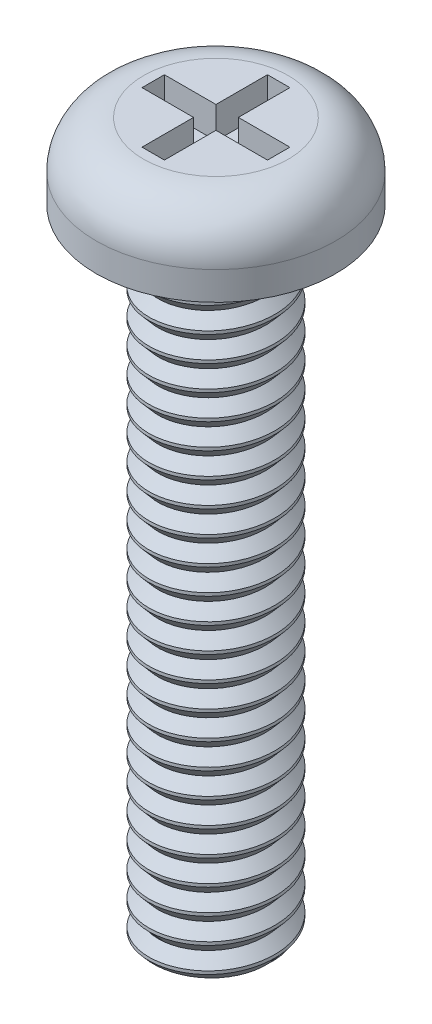
from build123d import *

# Parameters (mm, degrees)
SKETCH1_R           = 1.9
BOSS_EXTRUDE1_DEPTH = 1.2
CUT_EXTRUDE1_DEPTH  = 0.5
FILLET1_R           = 0.75
SKETCH3_R           = 1
BOSS_EXTRUDE2_DEPTH = 10
CUT_SWEEP1_PITCH    = 0.4
CUT_SWEEP1_TO       = 10


with BuildPart() as part:
    # Sketch1 → Boss-Extrude1 (new body)
    with BuildSketch(Plane(origin=(0, 0, 0), x_dir=(1, 0, 0), z_dir=(0, 1, 0))):
        with Locations(Location((0, 0, 0), (0, 0, 270))):
            Circle(SKETCH1_R)
    extrude(amount=BOSS_EXTRUDE1_DEPTH)

    # Sketch2 → Cut-Extrude1 (cut)
    with BuildSketch(Plane(origin=(0, 1.2, 0), x_dir=(1, 0, 0), z_dir=(0, 1, 0))):
        Polygon((-0.996132208, 0.177817561), (-0.996132208, -0.177817561), (-0.177817561, -0.177817561), (-0.177817561, -0.996132208), (0.177817561, -0.996132208), (0.177817561, -0.177817561), (0.996132208, -0.177817561), (0.996132208, 0.177817561), (0.177817561, 0.177817561), (0.177817561, 0.996132208), (-0.177817561, 0.996132208), (-0.177817561, 0.177817561), align=None)
    extrude(amount=-CUT_EXTRUDE1_DEPTH, mode=Mode.SUBTRACT)

    # Fillet1
    fillet1_edges = [part.edges().sort_by_distance(p)[0] for p in [
        (0, 1.2, -1.9),
    ]]
    fillet(fillet1_edges, radius=FILLET1_R)

    # Sketch3 → Boss-Extrude2 (add)
    with BuildSketch(Plane(origin=(0, 0, 0), x_dir=(1, 0, 0), z_dir=(0, 1, 0))):
        with Locations(Location((0, 0, 0), (0, 0, 270))):
            Circle(SKETCH3_R)
    extrude(amount=-BOSS_EXTRUDE2_DEPTH)

    # Cut-Sweep1: arcs per turn and ends read off the stored shape
    # Cut-Sweep1: the profile of Sketch4 profile screwed along a right-hand helix through 26.666667 turns, 6 arcs to a turn; built about Z, then put on its axis
    cut_sweep1_z = Axis((0, 0, 0), (0, 0, 1))
    cut_sweep1_corners = [(0.85, 0, -0.4), (1.0003, 0, -0.22465), (1.0003, 0, -0.57535)]
    with BuildLine(mode=Mode.PRIVATE) as cut_sweep1_profile:
        Line(cut_sweep1_corners[0], cut_sweep1_corners[1])
        Line(cut_sweep1_corners[1], cut_sweep1_corners[2])
        Line(cut_sweep1_corners[2], cut_sweep1_corners[0])
    cut_sweep1_cap = Face(cut_sweep1_profile.wire())
    cut_sweep1_turn_angles = [0, 30, 60, 90, 120, 150, 180, 210, 240, 270, 300, 330, 360]
    cut_sweep1_turn_weights = [1, 0.8660254037844387, 1, 0.8660254037844387, 1, 0.8660254037844387, 1, 0.8660254037844387, 1, 0.8660254037844387, 1, 0.8660254037844387, 1]
    cut_sweep1_turn_rails = [Edge.make_bspline([Vector(p[0], p[1], 0).rotate(cut_sweep1_z, cut_sweep1_turn_angles[k]) / cut_sweep1_turn_weights[k] + Vector(0, 0, p[2] + CUT_SWEEP1_PITCH * cut_sweep1_turn_angles[k] / 360) for k in range(13)], [0, 0, 0, 1, 1, 2, 2, 3, 3, 4, 4, 5, 5, 6, 6, 6], 2, cut_sweep1_turn_weights) for p in cut_sweep1_corners]
    cut_sweep1_turn_sides = [Face.make_surface_from_curves(cut_sweep1_turn_rails[p[0]], cut_sweep1_turn_rails[p[1]]) for p in [(0, 1), (1, 2), (2, 0)]]
    cut_sweep1_last_angles = [9360, 9390, 9420, 9450, 9480, 9510, 9540, 9570, 9600]
    cut_sweep1_last_weights = [1, 0.8660254037844387, 1, 0.8660254037844387, 1, 0.8660254037844387, 1, 0.8660254037844387, 1]
    cut_sweep1_last_rails = [Edge.make_bspline([Vector(p[0], p[1], 0).rotate(cut_sweep1_z, cut_sweep1_last_angles[k]) / cut_sweep1_last_weights[k] + Vector(0, 0, p[2] + CUT_SWEEP1_PITCH * cut_sweep1_last_angles[k] / 360) for k in range(9)], [0, 0, 0, 1, 1, 2, 2, 3, 3, 4, 4, 4], 2, cut_sweep1_last_weights) for p in cut_sweep1_corners]
    cut_sweep1_last_sides = [Face.make_surface_from_curves(cut_sweep1_last_rails[p[0]], cut_sweep1_last_rails[p[1]]) for p in [(0, 1), (1, 2), (2, 0)]]
    cut_sweep1 = Plane(origin=(0, -10, 0), x_dir=(1, 0, 0), z_dir=(0, 1, 0)) * split(Solid(Shell([*[p.moved(Location((0, 0, CUT_SWEEP1_PITCH * i))) for i in range(26) for p in cut_sweep1_turn_sides], *cut_sweep1_last_sides, cut_sweep1_cap, cut_sweep1_cap.rotate(cut_sweep1_z, 9600).moved(Location((0, 0, CUT_SWEEP1_PITCH * 9600 / 360)))])), bisect_by=Plane.XY.offset(CUT_SWEEP1_TO), keep=Keep.BOTTOM, mode=Mode.PRIVATE)
    add(cut_sweep1, mode=Mode.SUBTRACT)


solid = part.part
